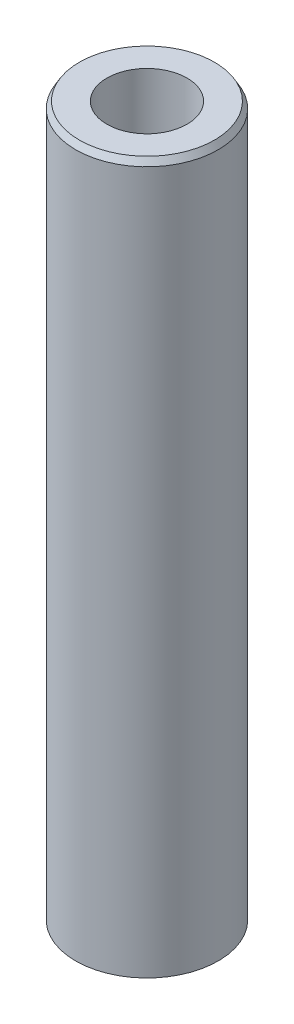
from build123d import *
from OCP.BRepFilletAPI import BRepFilletAPI_MakeChamfer

# Parameters (mm, degrees)
SKETCH1_R           = 60
BOSS_EXTRUDE1_DEPTH = 600
SKETCH2_R           = 33.725032425
CUT_EXTRUDE1_DEPTH  = 606.970296302
CHAMFER1_SIZE       = 5.453973437
CHAMFER1_SIZE2      = 3.148853032


with BuildPart() as part:
    # Sketch1 → Boss-Extrude1 (new body)
    with BuildSketch(Plane(origin=(0, 0, 0), x_dir=(1, 0, 0), z_dir=(0, 1, 0))):
        Circle(SKETCH1_R)
    extrude(amount=BOSS_EXTRUDE1_DEPTH)

    # Sketch2 → Cut-Extrude1 (cut, through all)
    with BuildSketch(Plane(origin=(0, 0, 0), x_dir=(1, 0, 0), z_dir=(0, 1, 0))):
        Circle(SKETCH2_R)
    extrude(amount=CUT_EXTRUDE1_DEPTH, mode=Mode.SUBTRACT)

    # Chamfer1: one chamfer whose edges measure the first distance from different faces: ONE call of the kernel's chamfer builder (chamfer() names one face for all edges)
    chamfer1_edges_1 = [part.edges().sort_by_distance(p)[0] for p in [
        (-60, 600, 0),
    ]]
    chamfer1_side_1 = [part.faces().sort_by_distance(p)[0] for p in [
        (-60, 300, 0),
    ]]
    chamfer1_edges_2 = [part.edges().sort_by_distance(p)[0] for p in [
        (-60, 0, 0),
    ]]
    chamfer1_side_2 = [part.faces().sort_by_distance(p)[0] for p in [
        (-58.302943725, 0, 0),
    ]]
    chamfer1 = BRepFilletAPI_MakeChamfer(part.part.solid().wrapped)
    for e in chamfer1_edges_1:
        chamfer1.Add(CHAMFER1_SIZE, CHAMFER1_SIZE2, e.wrapped, chamfer1_side_1[0].wrapped)  # the first distance lies on this face
    for e in chamfer1_edges_2:
        chamfer1.Add(CHAMFER1_SIZE, CHAMFER1_SIZE2, e.wrapped, chamfer1_side_2[0].wrapped)  # the first distance lies on this face
    add(Compound.cast(chamfer1.Shape()), mode=Mode.REPLACE)


solid = part.part
